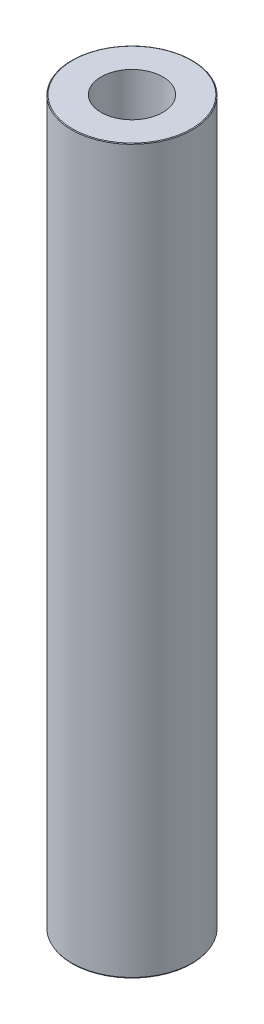
from build123d import *
from OCP.BRepFilletAPI import BRepFilletAPI_MakeChamfer

# Parameters (mm, degrees)
SKETCH1_R           = 50
BOSS_EXTRUDE1_DEPTH = 600
SKETCH2_R           = 25.615566661
CUT_EXTRUDE1_DEPTH  = 605.15229868
CHAMFER1_SIZE       = 0.397684547
CHAMFER1_SIZE2      = 0.688809841


with BuildPart() as part:
    # Sketch1 → Boss-Extrude1 (new body)
    with BuildSketch(Plane(origin=(0, 0, 0), x_dir=(1, 0, 0), z_dir=(0, 1, 0))):
        Circle(SKETCH1_R)
    extrude(amount=BOSS_EXTRUDE1_DEPTH)

    # Sketch2 → Cut-Extrude1 (cut, through all)
    with BuildSketch(Plane(origin=(0, 0, 0), x_dir=(1, 0, 0), z_dir=(0, 1, 0))):
        Circle(SKETCH2_R)
    extrude(amount=CUT_EXTRUDE1_DEPTH, mode=Mode.SUBTRACT)

    # Chamfer1: one chamfer whose edges measure the first distance from different faces: ONE call of the kernel's chamfer builder (chamfer() names one face for all edges)
    chamfer1_edges_1 = [part.edges().sort_by_distance(p)[0] for p in [
        (-50, 600, 0),
    ]]
    chamfer1_side_1 = [part.faces().sort_by_distance(p)[0] for p in [
        (-50, 300, 0),
    ]]
    chamfer1_edges_2 = [part.edges().sort_by_distance(p)[0] for p in [
        (-50, 0, 0),
    ]]
    chamfer1_side_2 = [part.faces().sort_by_distance(p)[0] for p in [
        (-48.585786438, 0, 0),
    ]]
    chamfer1 = BRepFilletAPI_MakeChamfer(part.part.solid().wrapped)
    for e in chamfer1_edges_1:
        chamfer1.Add(CHAMFER1_SIZE, CHAMFER1_SIZE2, e.wrapped, chamfer1_side_1[0].wrapped)  # the first distance lies on this face
    for e in chamfer1_edges_2:
        chamfer1.Add(CHAMFER1_SIZE, CHAMFER1_SIZE2, e.wrapped, chamfer1_side_2[0].wrapped)  # the first distance lies on this face
    add(Compound.cast(chamfer1.Shape()), mode=Mode.REPLACE)


solid = part.part
